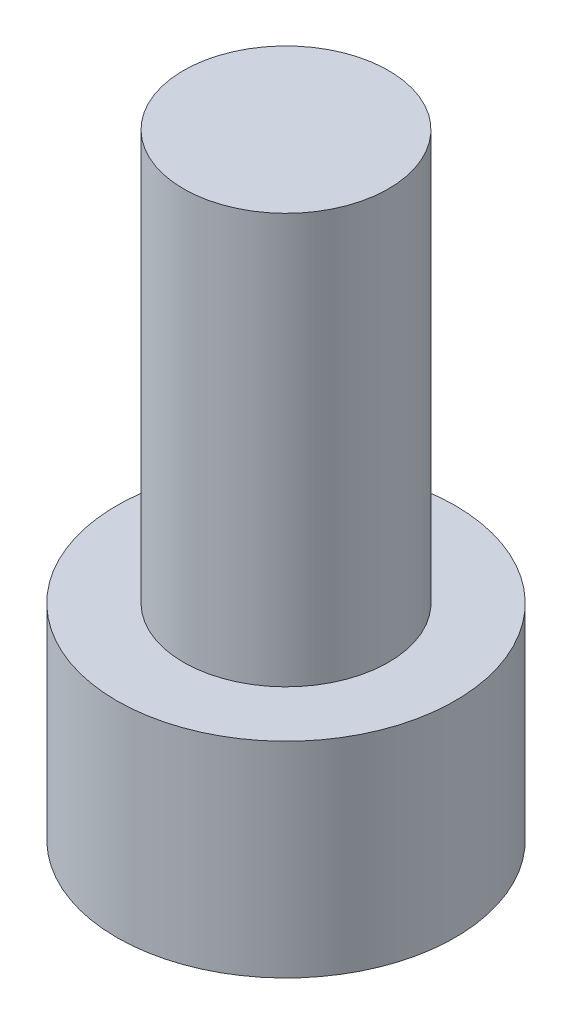
from build123d import *

# Parameters (mm, degrees)
SKETCH_1_R          = 6.6
EXTRUDE_1_DEPTH     = 8
SKETCH_2_R          = 4
EXTRUDE_2_DEPTH     = 16
CUT_EXTRUDE_1_DEPTH = 4


with BuildPart() as part:
    # 草图1 → 凸台-拉伸1 (new body)
    with BuildSketch(Plane(origin=(0, 0, 0), x_dir=(1, 0, 0), z_dir=(0, 1, 0))):
        Circle(SKETCH_1_R)
    extrude(amount=EXTRUDE_1_DEPTH)

    # 草图2 → 凸台-拉伸2 (add)
    with BuildSketch(Plane(origin=(0, 8, 0), x_dir=(1, 0, 0), z_dir=(0, 1, 0))):
        Circle(SKETCH_2_R)
    extrude(amount=EXTRUDE_2_DEPTH)

    # 草图3 → 切除-拉伸1 (cut)
    with BuildSketch(Plane.XZ):
        Polygon((2.805209528, -2.032436839), (3.162746698, 1.413164294), (0.357537171, 3.445601134), (-2.805209528, 2.032436839), (-3.162746698, -1.413164294), (-0.357537171, -3.445601134), align=None)
    extrude(amount=-CUT_EXTRUDE_1_DEPTH, mode=Mode.SUBTRACT)


solid = part.part
